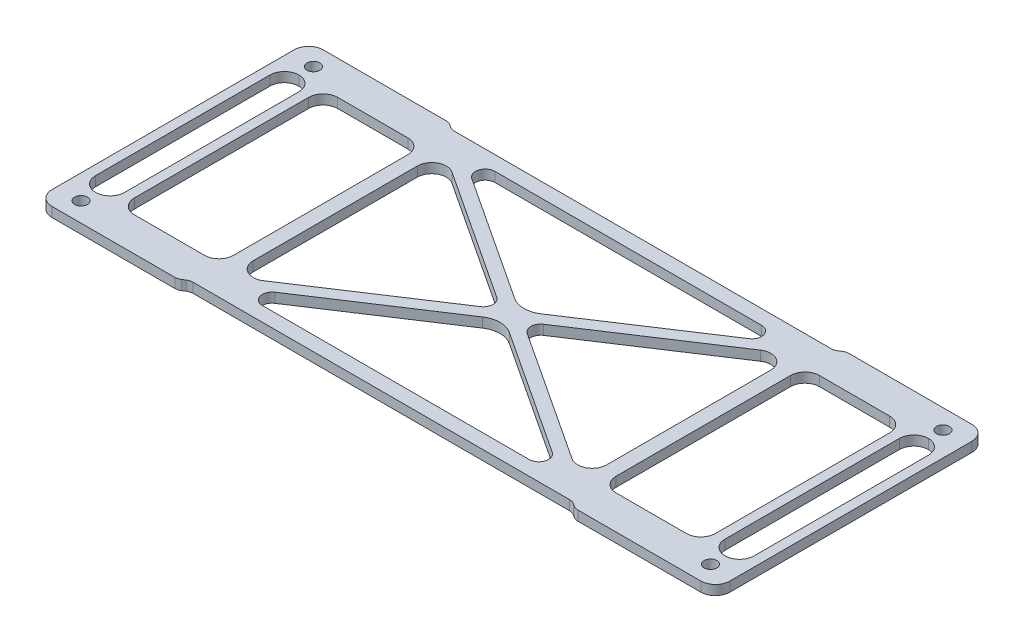
from build123d import *

# Parameters (mm, degrees)
SKETCH_1_W          = 140
SKETCH_1_H          = 56
SKETCH_1_R          = 1.325
EXTRUDE_1_DEPTH     = 2
SKETCH_3_W          = 20.5
SKETCH_3_H          = 42
SKETCH_3_W_2        = 6
CUT_EXTRUDE_1_DEPTH = 10
FILLET_1_R          = 3
FILLET_2_R          = 2
FILLET_3_R          = 3
FILLET_4_R          = 5
CUT_EXTRUDE_2_DEPTH = 76.41883054
FILLET_5_R          = 2


with BuildPart() as part:
    # 草图1 → 凸台-拉伸1 (new body)
    with BuildSketch(Plane(origin=(0, 0, 0), x_dir=(1, 0, 0), z_dir=(0, 1, 0))):
        Rectangle(SKETCH_1_W, SKETCH_1_H)
        with Locations(Location((-65, 24, 0), (0, 0, 270))):
            Circle(SKETCH_1_R, mode=Mode.SUBTRACT)
        with Locations(Location((65, 24, 0), (0, 0, 270))):
            Circle(SKETCH_1_R, mode=Mode.SUBTRACT)
        with Locations(Location((65, -24, 0), (0, 0, 270))):
            Circle(SKETCH_1_R, mode=Mode.SUBTRACT)
        with Locations(Location((-65, -24, 0), (0, 0, 270))):
            Circle(SKETCH_1_R, mode=Mode.SUBTRACT)
    extrude(amount=EXTRUDE_1_DEPTH)

    # 草图3 → 切除-拉伸1 (cut)
    with BuildSketch(Plane(origin=(0, 2, 0), x_dir=(1, 0, 0), z_dir=(0, 1, 0))):
        with Locations((-49.75, 0)):
            Rectangle(SKETCH_3_W, SKETCH_3_H)
        with Locations((-65, 0)):
            Rectangle(SKETCH_3_W_2, SKETCH_3_H)
        Polygon((-36.5, -22.50398901), (-2.275183381, 0), (-36.5, 22.50398901), align=None)
        Polygon((34.224816619, 24), (-34.224816619, 24), (0, 1.49601099), align=None)
        Polygon((36.5, 22.50398901), (2.275183381, 0), (36.5, -22.50398901), align=None)
        Polygon((34.224816619, -24), (0, -1.49601099), (-34.224816619, -24), align=None)
        with Locations((49.75, 0)):
            Rectangle(SKETCH_3_W, SKETCH_3_H)
        with Locations((65, 0)):
            Rectangle(SKETCH_3_W_2, SKETCH_3_H)
    extrude(amount=-CUT_EXTRUDE_1_DEPTH, mode=Mode.SUBTRACT)

    # 圆角1
    fillet_1_edges = [part.edges().sort_by_distance(p)[0] for p in [
        (68, 1, -21),
        (68, 1, 21),
        (62, 1, 21),
        (62, 1, -21),
        (-60, 1, 21),
        (-60, 1, -21),
        (-39.5, 1, -21),
        (-39.5, 1, 21),
        (70, 1, 28),
        (-70, 1, 28),
        (-70, 1, -28),
        (70, 1, -28),
        (-62, 1, -21),
        (-62, 1, 21),
        (-68, 1, 21),
        (-68, 1, -21),
        (60, 1, -21),
        (60, 1, 21),
        (39.5, 1, 21),
        (39.5, 1, -21),
    ]]
    fillet(fillet_1_edges, radius=FILLET_1_R - 0.0001)  # a hair under: the kernel refuses the full size

    # 圆角2
    fillet_2_edges = [part.edges().sort_by_distance(p)[0] for p in [
        (-34.224816619, 1, -24),
        (34.224816619, 1, -24),
        (2.275183381, 1, 0),
        (-2.275183381, 1, 0),
        (-34.224816619, 1, 24),
        (34.224816619, 1, 24),
    ]]
    fillet(fillet_2_edges, radius=FILLET_2_R)

    # 圆角3
    fillet_3_edges = [part.edges().sort_by_distance(p)[0] for p in [
        (36.5, 1, -22.50398901),
        (36.5, 1, 22.50398901),
        (-36.5, 1, -22.50398901),
        (-36.5, 1, 22.50398901),
    ]]
    fillet(fillet_3_edges, radius=FILLET_3_R)

    # 圆角4
    fillet_4_edges = [part.edges().sort_by_distance(p)[0] for p in [
        (0, 1, -1.49601099),
        (0, 1, 1.49601099),
    ]]
    fillet(fillet_4_edges, radius=FILLET_4_R)

    # 草图4 → 切除-拉伸2 (cut, through all)
    with BuildSketch(Plane(origin=(0, 2, 0), x_dir=(1, 0, 0), z_dir=(0, 1, 0))):
        Polygon((-41.020833333, 28), (-39.5, 27), (39.5, 27), (41.020833333, 28), align=None)
        Polygon((41.020833333, -28), (39.5, -27), (-39.5, -27), (-41.020833333, -28), align=None)
    extrude(amount=-CUT_EXTRUDE_2_DEPTH, mode=Mode.SUBTRACT)

    # 圆角5
    fillet_5_edges = [part.edges().sort_by_distance(p)[0] for p in [
        (-41.020833333, 1, -28),
        (41.020833333, 1, -28),
        (39.5, 1, -27),
        (-39.5, 1, -27),
        (41.020833333, 1, 28),
        (-41.020833333, 1, 28),
        (-39.5, 1, 27),
        (39.5, 1, 27),
    ]]
    fillet(fillet_5_edges, radius=FILLET_5_R)


solid = part.part
